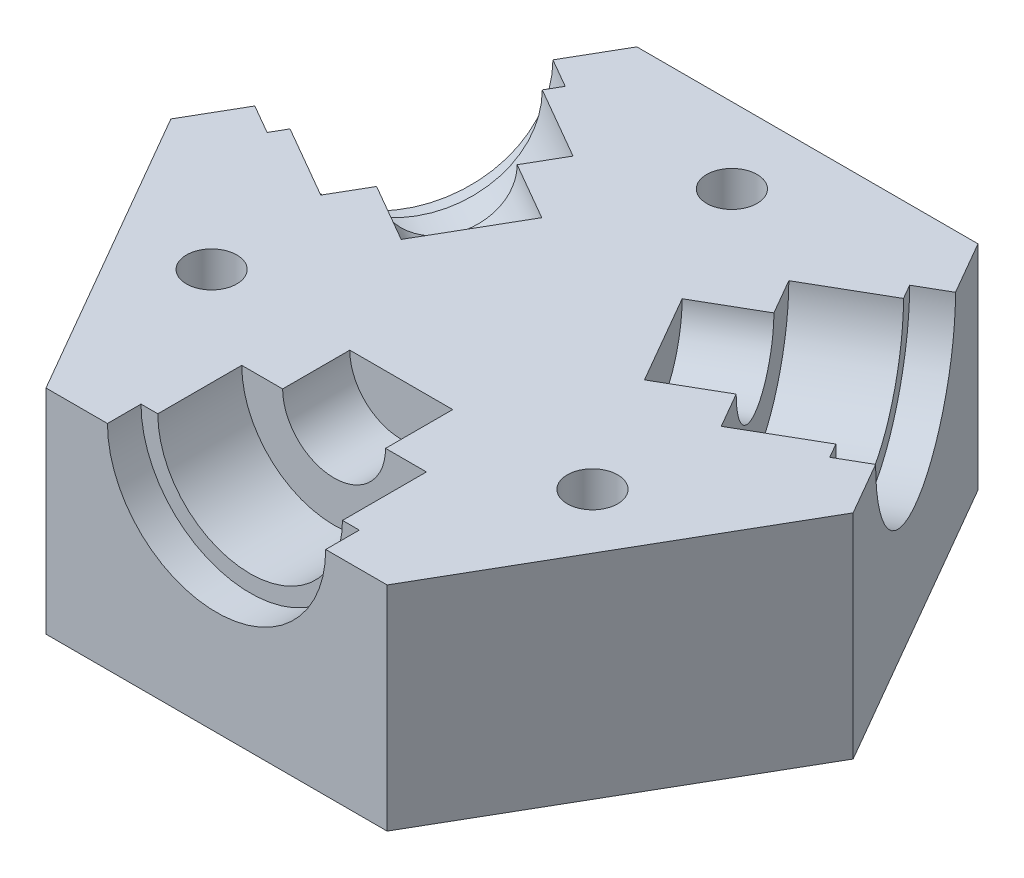
from build123d import *

# Parameters (mm, degrees)
BOSS_EXTRUDE1_DEPTH = 12.7
CIRPATTERN1_COUNT   = 3
SKETCH7_R           = 1.5
CUT_EXTRUDE2_DEPTH  = 6.35


with BuildPart() as part:
    # Sketch1 → Boss-Extrude1 (new body)
    with BuildSketch(Plane(origin=(0, 0, 0), x_dir=(1, 0, 0), z_dir=(0, 1, 0))):
        Polygon((10.16, -17.597636205), (20.32, 0), (10.16, 17.597636205), (-10.16, 17.597636205), (-20.32, 0), (-10.16, -17.597636205), align=None)
    extrude(amount=BOSS_EXTRUDE1_DEPTH)

    # Sketch5 → Cut-Revolve1 (revolve, cut)
    with BuildSketch(Plane(origin=(0, 12.7, 0), x_dir=(1, 0, 0), z_dir=(0, 1, 0))):
        Polygon((0, -17.597636205), (0, -6.597636205), (-3.065310501, -6.597636205), (-3.065310501, -10.597636205), (-5.5, -10.597636205), (-5.5, -15.597636205), (-6.5, -15.597636205), (-6.5, -17.597636205), align=None)
    cut_revolve1 = revolve(axis=Axis((0, 12.7, 17.597636205), (0, 0, -1)), mode=Mode.SUBTRACT)

    # CirPattern1: Cut-Revolve1 ×3 about axis
    cirpattern1_axis = Axis((0, -0.635, 0), (0, 1, 0))
    for i in range(1, CIRPATTERN1_COUNT):
        add(cut_revolve1.rotate(cirpattern1_axis, i * 360 / CIRPATTERN1_COUNT), mode=Mode.SUBTRACT)

    # Sketch7 → Cut-Extrude2 (cut)
    with BuildSketch(Plane(origin=(0, 12.7, 0), x_dir=(1, 0, 0), z_dir=(0, 1, 0))):
        with Locations((0, 13.097642205)):
            Circle(SKETCH7_R)
        with Locations((11.342887415, -6.548815102)):
            Circle(SKETCH7_R)
        with Locations((-11.342887415, -6.548815102)):
            Circle(SKETCH7_R)
    extrude(amount=-CUT_EXTRUDE2_DEPTH, mode=Mode.SUBTRACT)


solid = part.part
